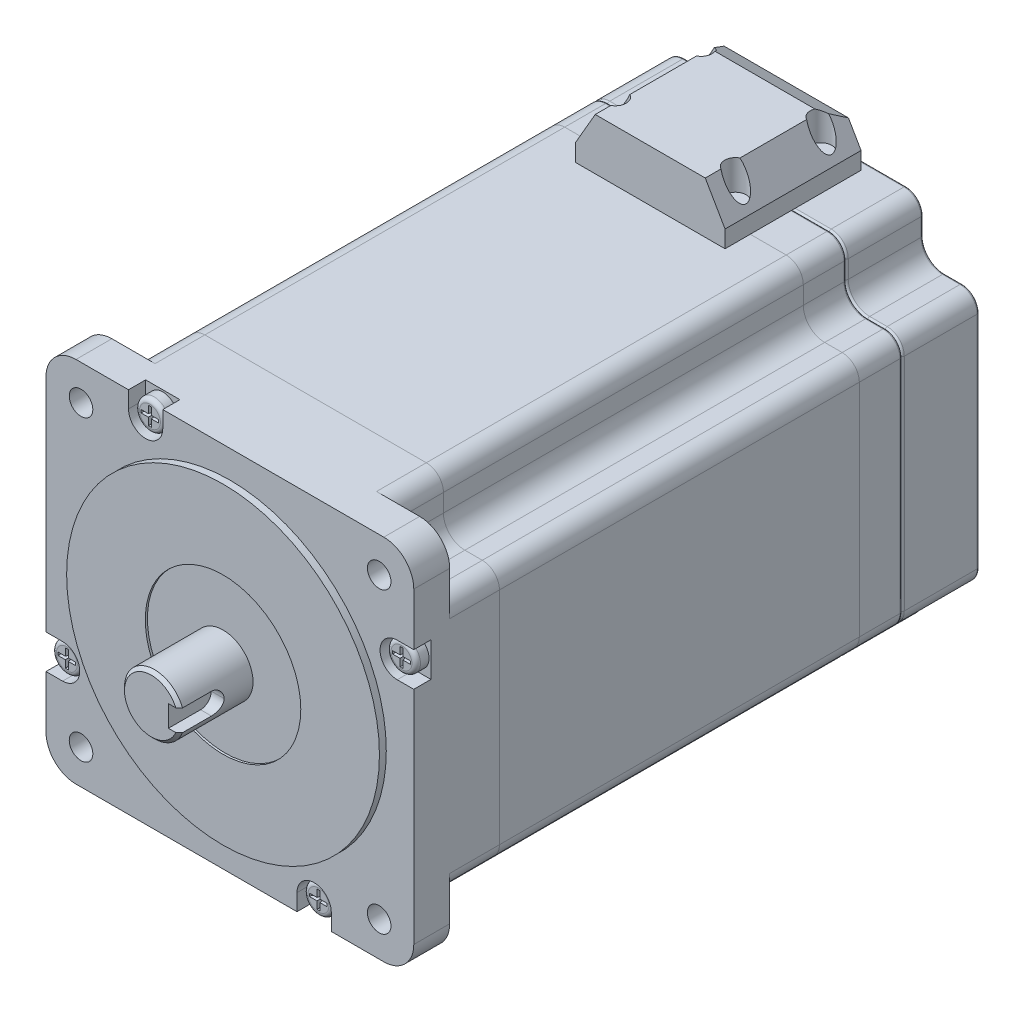
from build123d import *
from OCP.BRepFilletAPI import BRepFilletAPI_MakeChamfer

# Parameters (mm, degrees)
SKETCH1_R                = 2.75
BOSS_EXTRUDE1_DEPTH      = 114
SKETCH2_R                = 36.51
BOSS_EXTRUDE2_DEPTH      = 1.6
BOSS_EXTRUDE3_DEPTH      = 31.75
BOSS_EXTRUDE3_DEPTH_BACK = 5
SKETCH3_R                = 7
SKETCH4_W                = 5
SKETCH4_H                = 5
CUT_EXTRUDE1_DEPTH       = 25
FILLET1_R                = 2.5
CHAMFER1_SIZE            = 0.5
SKETCH5_R                = 18.150459798
CUT_EXTRUDE2_DEPTH       = 0.5
CUT_EXTRUDE3_DEPTH       = 105.62
FILLET2_R                = 0.5
FILLET3_R                = 4
SKETCH8_R                = 10
CUT_EXTRUDE4_DEPTH       = 1
SKETCH9_R                = 6
BOSS_EXTRUDE4_DEPTH      = 0.8
CUT_EXTRUDE5_DEPTH       = 4
SKETCH11_R               = 3.434192677
BOSS_EXTRUDE5_DEPTH      = 3
FILLET4_R                = 1
CUT_EXTRUDE6_DEPTH       = 2
CUT_EXTRUDE6_DRAFT       = -6
CHAMFER2_SIZE            = 1.5
CHAMFER2_SIZE2           = 1.685405696
CIRPATTERN3_COUNT        = 4
BOSS_EXTRUDE6_DEPTH      = 18
FILLET6_R                = 0.5
SKETCH15_R               = 10
CUT_EXTRUDE7_DEPTH       = 15
CHAMFER3_SIZE            = 0.75
SKETCH16_W               = 31.75
SKETCH16_H               = 34.925
BOSS_EXTRUDE7_DEPTH      = 12
CHAMFER4_SIZE            = 8
CHAMFER4_SIZE2           = 4.618802154
CHAMFER5_SIZE            = 5
CHAMFER5_SIZE2           = 2.886751346
SKETCH17_R               = 2.5
CUT_EXTRUDE8_DEPTH       = 7


# Some blends are built 0.0001 mm under size
with BuildPart() as part:
    # Sketch1 → Boss-Extrude1 (new body)
    with BuildSketch(Plane.XY):
        with BuildLine():
            Line((-35.925, -42.925), (35.925, -42.925))
            ThreePointArc((35.925, -42.925), (40.874747468, -40.874747468), (42.925, -35.925))
            Line((42.925, -35.925), (42.925, 35.925))
            ThreePointArc((42.925, 35.925), (40.874747468, 40.874747468), (35.925, 42.925))
            Line((35.925, 42.925), (-35.925, 42.925))
            ThreePointArc((-35.925, 42.925), (-40.874747468, 40.874747468), (-42.925, 35.925))
            Line((-42.925, 35.925), (-42.925, -35.925))
            ThreePointArc((-42.925, -35.925), (-40.874747468, -40.874747468), (-35.925, -42.925))
        make_face()
        with Locations(Location((-34.75, 34.75, 0), (0, 0, 180))):
            Circle(SKETCH1_R, mode=Mode.SUBTRACT)
        with Locations(Location((34.846985, 34.75, 0), (0, 0, 180))):
            Circle(SKETCH1_R, mode=Mode.SUBTRACT)
        with Locations(Location((-34.75, -34.846985, 0), (0, 0, 180))):
            Circle(SKETCH1_R, mode=Mode.SUBTRACT)
        with Locations(Location((34.846985, -34.846985, 0), (0, 0, 180))):
            Circle(SKETCH1_R, mode=Mode.SUBTRACT)
    extrude(amount=BOSS_EXTRUDE1_DEPTH)

    # Sketch2 → Boss-Extrude2 (add)
    with BuildSketch(Plane.XY.offset(114)):
        Circle(SKETCH2_R)
    extrude(amount=BOSS_EXTRUDE2_DEPTH)

    # Sketch3 → Boss-Extrude3 (add, two sides: drawn at the far end of the back side and taken through both)
    with BuildSketch(Plane.XY.offset(115.6).offset(-BOSS_EXTRUDE3_DEPTH_BACK)):
        Circle(SKETCH3_R)
    extrude(amount=BOSS_EXTRUDE3_DEPTH + BOSS_EXTRUDE3_DEPTH_BACK)

    # Sketch4 → Cut-Extrude1 (cut)
    with BuildSketch(Plane.XY.offset(147.35)):
        with Locations((6.5, 0)):
            Rectangle(SKETCH4_W, SKETCH4_H)
    extrude(amount=-CUT_EXTRUDE1_DEPTH, mode=Mode.SUBTRACT)

    # Fillet1
    fillet1_edges = [part.edges().sort_by_distance(p)[0] for p in [
        (5.269174208, -2.5, 122.35),
        (5.269174208, 2.5, 122.35),
    ]]
    fillet(fillet1_edges, radius=FILLET1_R - 0.0001)  # a hair under: the kernel refuses the full size

    # Chamfer1
    chamfer1_edges = [part.edges().sort_by_distance(p)[0] for p in [
        (-7, 0, 147.35),
    ]]
    chamfer(chamfer1_edges, length=CHAMFER1_SIZE)

    # Sketch5 → Cut-Extrude2 (cut)
    with BuildSketch(Plane.XY.offset(115.6)):
        Circle(SKETCH5_R)
    extrude(amount=-CUT_EXTRUDE2_DEPTH, mode=Mode.SUBTRACT)


with BuildPart() as cut_extrude2_piece_1:
    # of the separate pieces the step leaves, piece 1, a body of its own (cut_extrude2_pieces)
    add(part.part.solids().sort_by_distance((36.51, 0, 115.6))[0])

    # Sketch6 → Cut-Extrude3 (cut)
    with BuildSketch(Plane(origin=(0, 0, 0), x_dir=(-1, 0, 0), z_dir=(0, 0, -1))):
        with BuildLine():
            Line((-29.846985, 34.75), (-29.846985, 42.925))
            Line((-29.846985, 42.925), (-35.925, 42.925))
            ThreePointArc((-35.925, 42.925), (-40.874747468, 40.874747468), (-42.925, 35.925))
            Line((-42.925, 35.925), (-42.925, 29.75))
            Line((-42.925, 29.75), (-34.846985, 29.75))
            ThreePointArc((-34.846985, 29.75), (-31.311451094, 31.214466094), (-29.846985, 34.75))
        make_face()
        with BuildLine():
            Line((35.925, 42.925), (29.846985, 42.925))
            Line((29.846985, 42.925), (29.846985, 34.75))
            ThreePointArc((29.846985, 34.75), (31.311451094, 31.214466094), (34.846985, 29.75))
            Line((34.846985, 29.75), (42.925, 29.75))
            Line((42.925, 29.75), (42.925, 35.925))
            ThreePointArc((42.925, 35.925), (40.874747468, 40.874747468), (35.925, 42.925))
        make_face()
        with BuildLine():
            Line((29.846985, -34.75), (29.846985, -42.925))
            Line((29.846985, -42.925), (35.925, -42.925))
            ThreePointArc((35.925, -42.925), (40.874747468, -40.874747468), (42.925, -35.925))
            Line((42.925, -35.925), (42.925, -29.75))
            Line((42.925, -29.75), (34.846985, -29.75))
            ThreePointArc((34.846985, -29.75), (31.311451094, -31.214466094), (29.846985, -34.75))
        make_face()
        with BuildLine():
            Line((-35.925, -42.925), (-29.846985, -42.925))
            Line((-29.846985, -42.925), (-29.846985, -34.75))
            ThreePointArc((-29.846985, -34.75), (-31.311451094, -31.214466094), (-34.846985, -29.75))
            Line((-34.846985, -29.75), (-42.925, -29.75))
            Line((-42.925, -29.75), (-42.925, -35.925))
            ThreePointArc((-42.925, -35.925), (-40.874747468, -40.874747468), (-35.925, -42.925))
        make_face()
    extrude(amount=-CUT_EXTRUDE3_DEPTH, mode=Mode.SUBTRACT)

    # Fillet2
    fillet2_edges = [cut_extrude2_piece_1.edges().sort_by_distance(p)[0] for p in [
        (0, 42.925, 0),
        (31.311451094, 31.214466094, 0),
        (29.846985, 38.8375, 0),
        (38.8859925, 29.75, 0),
        (-42.925, 0, 0),
        (-29.846985, 38.8375, 0),
        (-31.311451094, 31.214466094, 0),
        (-38.8859925, 29.75, 0),
        (0, -42.925, 0),
        (-31.311451094, -31.214466094, 0),
        (-29.846985, -38.8375, 0),
        (-38.8859925, -29.75, 0),
        (42.925, 0, 0),
        (29.846985, -38.8375, 0),
        (31.311451094, -31.214466094, 0),
        (38.8859925, -29.75, 0),
    ]]
    fillet(fillet2_edges, radius=FILLET2_R)

    # Fillet3
    # the kernel refuses this fillet: 4 mm, written as the material it takes off along each edge
    with BuildSketch(Plane(origin=(-38.925, 25.75, 0), x_dir=(-1, 0, 0), z_dir=(0, -1, 0))) as fillet3_piece_1:
        with BuildLine():
            CenterArc((3.5, -0.5), 0.5, 0, 90)
            Line((4, -0.5), (4, 0))
            Line((4, 0), (3.5, 0))
        make_face()
    revolve(axis=Axis((-38.925, 25.75, 0), (0, 0, -1)), revolution_arc=90, mode=Mode.SUBTRACT)
    with BuildSketch(Plane(origin=(-38.925, -25.75, 0), x_dir=(0, -1, 0), z_dir=(1, 0, 0))) as fillet3_piece_2:
        with BuildLine():
            CenterArc((3.5, -0.5), 0.5, 0, 90)
            Line((4, -0.5), (4, 0))
            Line((4, 0), (3.5, 0))
        make_face()
    revolve(axis=Axis((-38.925, -25.75, 0), (0, 0, -1)), revolution_arc=90, mode=Mode.SUBTRACT)
    with BuildSketch(Plane(origin=(-25.846985, 38.925, 0), x_dir=(-1, 0, 0), z_dir=(0, -1, 0))) as fillet3_piece_3:
        with BuildLine():
            CenterArc((3.5, -0.5), 0.5, 0, 90)
            Line((4, -0.5), (4, 0))
            Line((4, 0), (3.5, 0))
        make_face()
    revolve(axis=Axis((-25.846985, 38.925, 0), (0, 0, -1)), revolution_arc=90, mode=Mode.SUBTRACT)
    with BuildSketch(Plane(origin=(25.846985, 38.925, 0), x_dir=(0, 1, 0), z_dir=(-1, 0, 0))) as fillet3_piece_4:
        with BuildLine():
            CenterArc((3.5, -0.5), 0.5, 0, 90)
            Line((4, -0.5), (4, 0))
            Line((4, 0), (3.5, 0))
        make_face()
    revolve(axis=Axis((25.846985, 38.925, 0), (0, 0, -1)), revolution_arc=90, mode=Mode.SUBTRACT)
    with BuildSketch(Plane(origin=(-25.846985, -38.925, 0), x_dir=(0, -1, 0), z_dir=(1, 0, 0))) as fillet3_piece_5:
        with BuildLine():
            CenterArc((3.5, -0.5), 0.5, 0, 90)
            Line((4, -0.5), (4, 0))
            Line((4, 0), (3.5, 0))
        make_face()
    revolve(axis=Axis((-25.846985, -38.925, 0), (0, 0, -1)), revolution_arc=90, mode=Mode.SUBTRACT)
    with BuildSketch(Plane(origin=(25.846985, -38.925, 0), x_dir=(1, 0, 0), z_dir=(0, 1, 0))) as fillet3_piece_6:
        with BuildLine():
            CenterArc((3.5, -0.5), 0.5, 0, 90)
            Line((4, -0.5), (4, 0))
            Line((4, 0), (3.5, 0))
        make_face()
    revolve(axis=Axis((25.846985, -38.925, 0), (0, 0, -1)), revolution_arc=90, mode=Mode.SUBTRACT)
    with BuildSketch(Plane(origin=(38.925, 25.75, 0), x_dir=(0, 1, 0), z_dir=(-1, 0, 0))) as fillet3_piece_7:
        with BuildLine():
            CenterArc((3.5, -0.5), 0.5, 0, 90)
            Line((4, -0.5), (4, 0))
            Line((4, 0), (3.5, 0))
        make_face()
    revolve(axis=Axis((38.925, 25.75, 0), (0, 0, -1)), revolution_arc=90, mode=Mode.SUBTRACT)
    with BuildSketch(Plane(origin=(38.925, -25.75, 0), x_dir=(1, 0, 0), z_dir=(0, 1, 0))) as fillet3_piece_8:
        with BuildLine():
            CenterArc((3.5, -0.5), 0.5, 0, 90)
            Line((4, -0.5), (4, 0))
            Line((4, 0), (3.5, 0))
        make_face()
    revolve(axis=Axis((38.925, -25.75, 0), (0, 0, -1)), revolution_arc=90, mode=Mode.SUBTRACT)
    with BuildSketch(Plane(origin=(-42.925, -29.75, 0), x_dir=(0, 1, 0), z_dir=(0, 0, 1)), Plane(origin=(-29.846985, 42.925, 0), x_dir=(1, 0, 0), z_dir=(0, 0, 1)), Plane(origin=(42.925, 29.75, 0), x_dir=(0, -1, 0), z_dir=(0, 0, 1)), Plane(origin=(29.846985, -42.925, 0), x_dir=(-1, 0, 0), z_dir=(0, 0, 1)), Plane(origin=(-29.846985, -42.925, 0), x_dir=(0, 1, 0), z_dir=(0, 0, 1))) as fillet3_piece_9:
        with BuildLine():
            CenterArc((FILLET3_R, -FILLET3_R), FILLET3_R, 90, 90)
            Line((0, -FILLET3_R), (0, 0))
            Line((0, 0), (FILLET3_R, 0))
        make_face()
    extrude(amount=105.62, mode=Mode.SUBTRACT)
    with BuildSketch(Plane(origin=(-42.925, 29.75, 0), x_dir=(0, -1, 0), z_dir=(0, 0, 1)), Plane(origin=(29.846985, 42.925, 0), x_dir=(-1, 0, 0), z_dir=(0, 0, 1)), Plane(origin=(42.925, -29.75, 0), x_dir=(0, 1, 0), z_dir=(0, 0, 1))) as fillet3_piece_10:
        with BuildLine():
            CenterArc((FILLET3_R, FILLET3_R), FILLET3_R, 180, 90)
            Line((0, FILLET3_R), (0, 0))
            Line((0, 0), (FILLET3_R, 0))
        make_face()
    extrude(amount=105.62, mode=Mode.SUBTRACT)

    # Sketch8 → Cut-Extrude4 (cut)
    with BuildSketch(Plane(origin=(0, 0, 0), x_dir=(-1, 0, 0), z_dir=(0, 0, -1))):
        Circle(SKETCH8_R)
    extrude(amount=-CUT_EXTRUDE4_DEPTH, mode=Mode.SUBTRACT)

    # Sketch10 → Cut-Extrude5 (cut)
    with BuildSketch(Plane.XY.offset(114)):
        with BuildLine():
            Line((-23.668230311, 39.056860772), (-23.668230311, 42.925))
            Line((-23.668230311, 42.925), (-15.668230311, 42.925))
            Line((-15.668230311, 42.925), (-15.668230311, 39.056860772))
            ThreePointArc((-15.668230311, 39.056860772), (-19.668230311, 35.056860772), (-23.668230311, 39.056860772))
        make_face()
        with BuildLine():
            Line((39.056860772, 23.668230311), (42.925, 23.668230311))
            Line((42.925, 23.668230311), (42.925, 15.668230311))
            Line((42.925, 15.668230311), (39.056860772, 15.668230311))
            ThreePointArc((39.056860772, 15.668230311), (35.056860772, 19.668230311), (39.056860772, 23.668230311))
        make_face()
        with BuildLine():
            Line((23.668230311, -39.056860772), (23.668230311, -42.925))
            Line((23.668230311, -42.925), (15.668230311, -42.925))
            Line((15.668230311, -42.925), (15.668230311, -39.056860772))
            ThreePointArc((15.668230311, -39.056860772), (19.668230311, -35.056860772), (23.668230311, -39.056860772))
        make_face()
        with BuildLine():
            Line((-39.056860772, -23.668230311), (-42.925, -23.668230311))
            Line((-42.925, -23.668230311), (-42.925, -15.668230311))
            Line((-42.925, -15.668230311), (-39.056860772, -15.668230311))
            ThreePointArc((-39.056860772, -15.668230311), (-35.056860772, -19.668230311), (-39.056860772, -23.668230311))
        make_face()
    extrude(amount=-CUT_EXTRUDE5_DEPTH, mode=Mode.SUBTRACT)

    # Sketch14 → Boss-Extrude6 (add)
    with BuildSketch(Plane(origin=(0, 0, 0), x_dir=(-1, 0, 0), z_dir=(0, 0, -1))):
        with BuildLine():
            Line((-25.846985, 42.925), (25.846985, 42.925))
            ThreePointArc((25.846985, 42.925), (28.675412125, 41.753427125), (29.846985, 38.925))
            Line((29.846985, 38.925), (29.846985, 34.75))
            ThreePointArc((29.846985, 34.75), (31.311451094, 31.214466094), (34.846985, 29.75))
            Line((34.846985, 29.75), (38.925, 29.75))
            ThreePointArc((38.925, 29.75), (41.753427125, 28.578427125), (42.925, 25.75))
            Line((42.925, 25.75), (42.925, -25.75))
            ThreePointArc((42.925, -25.75), (41.753427125, -28.578427125), (38.925, -29.75))
            Line((38.925, -29.75), (34.846985, -29.75))
            ThreePointArc((34.846985, -29.75), (31.311451094, -31.214466094), (29.846985, -34.75))
            Line((29.846985, -34.75), (29.846985, -38.925))
            ThreePointArc((29.846985, -38.925), (28.675412125, -41.753427125), (25.846985, -42.925))
            Line((25.846985, -42.925), (-25.846985, -42.925))
            ThreePointArc((-25.846985, -42.925), (-28.675412125, -41.753427125), (-29.846985, -38.925))
            Line((-29.846985, -38.925), (-29.846985, -34.75))
            ThreePointArc((-29.846985, -34.75), (-31.311451094, -31.214466094), (-34.846985, -29.75))
            Line((-34.846985, -29.75), (-38.925, -29.75))
            ThreePointArc((-38.925, -29.75), (-41.753427125, -28.578427125), (-42.925, -25.75))
            Line((-42.925, -25.75), (-42.925, 25.75))
            ThreePointArc((-42.925, 25.75), (-41.753427125, 28.578427125), (-38.925, 29.75))
            Line((-38.925, 29.75), (-34.846985, 29.75))
            ThreePointArc((-34.846985, 29.75), (-31.311451094, 31.214466094), (-29.846985, 34.75))
            Line((-29.846985, 34.75), (-29.846985, 38.925))
            ThreePointArc((-29.846985, 38.925), (-28.675412125, 41.753427125), (-25.846985, 42.925))
        make_face()
    extrude(amount=BOSS_EXTRUDE6_DEPTH)

    # Fillet6
    fillet6_edges = [cut_extrude2_piece_1.edges().sort_by_distance(p)[0] for p in [
        (28.675412125, 41.753427125, 0),
        (29.846985, 36.8375, 0),
        (31.311451094, 31.214466094, 0),
        (36.8859925, 29.75, 0),
        (41.753427125, 28.578427125, 0),
        (42.925, 0, 0),
        (41.753427125, -28.578427125, 0),
        (36.8859925, -29.75, 0),
        (31.311451094, -31.214466094, 0),
        (29.846985, -36.8375, 0),
        (28.675412125, -41.753427125, 0),
        (0, -42.925, 0),
        (-28.675412125, -41.753427125, 0),
        (-29.846985, -36.8375, 0),
        (-31.311451094, -31.214466094, 0),
        (-36.8859925, -29.75, 0),
        (-41.753427125, -28.578427125, 0),
        (-42.925, 0, 0),
        (-41.753427125, 28.578427125, 0),
        (-36.8859925, 29.75, 0),
        (-31.311451094, 31.214466094, 0),
        (-29.846985, 36.8375, 0),
        (-28.675412125, 41.753427125, 0),
        (0, 42.925, 0),
        (28.675412125, 41.753427125, -18),
        (29.846985, 36.8375, -18),
        (31.311451094, 31.214466094, -18),
        (36.8859925, 29.75, -18),
        (41.753427125, 28.578427125, -18),
        (42.925, 0, -18),
        (41.753427125, -28.578427125, -18),
        (36.8859925, -29.75, -18),
        (31.311451094, -31.214466094, -18),
        (29.846985, -36.8375, -18),
        (28.675412125, -41.753427125, -18),
        (0, -42.925, -18),
        (-28.675412125, -41.753427125, -18),
        (-29.846985, -36.8375, -18),
        (-31.311451094, -31.214466094, -18),
        (-36.8859925, -29.75, -18),
        (-41.753427125, -28.578427125, -18),
        (-42.925, 0, -18),
        (-41.753427125, 28.578427125, -18),
        (-36.8859925, 29.75, -18),
        (-31.311451094, 31.214466094, -18),
        (-29.846985, 36.8375, -18),
        (-28.675412125, 41.753427125, -18),
        (0, 42.925, -18),
    ]]
    fillet(fillet6_edges, radius=FILLET6_R - 0.0001)  # a hair under: the kernel refuses the full size

    # Sketch16 → Boss-Extrude7 (add)
    with BuildSketch(Plane(origin=(0, 42.925, 0), x_dir=(0, 0, 1), z_dir=(0, -1, 0))):
        Rectangle(SKETCH16_W, SKETCH16_H)
    extrude(amount=-BOSS_EXTRUDE7_DEPTH)

    # Chamfer4: one chamfer whose edges measure the first distance from different faces: ONE call of the kernel's chamfer builder (chamfer() names one face for all edges)
    chamfer4_edges_1 = [cut_extrude2_piece_1.edges().sort_by_distance(p)[0] for p in [
        (-17.4625, 54.925, 0),
    ]]
    chamfer4_side_1 = [cut_extrude2_piece_1.faces().sort_by_distance(p)[0] for p in [
        (-17.4625, 48.925, 0),
    ]]
    chamfer4_edges_2 = [cut_extrude2_piece_1.edges().sort_by_distance(p)[0] for p in [
        (17.4625, 54.925, 0),
    ]]
    chamfer4_side_2 = [cut_extrude2_piece_1.faces().sort_by_distance(p)[0] for p in [
        (17.4625, 48.925, 0),
    ]]
    chamfer4 = BRepFilletAPI_MakeChamfer(cut_extrude2_piece_1.part.solid().wrapped)
    for e in chamfer4_edges_1:
        chamfer4.Add(CHAMFER4_SIZE, CHAMFER4_SIZE2, e.wrapped, chamfer4_side_1[0].wrapped)  # the first distance lies on this face
    for e in chamfer4_edges_2:
        chamfer4.Add(CHAMFER4_SIZE, CHAMFER4_SIZE2, e.wrapped, chamfer4_side_2[0].wrapped)  # the first distance lies on this face
    add(Compound.cast(chamfer4.Shape()), mode=Mode.REPLACE)

    # Chamfer5
    chamfer5_edges = [cut_extrude2_piece_1.edges().sort_by_distance(p)[0] for p in [
        (0, 54.925, -15.875),
    ]]
    chamfer5_side = [cut_extrude2_piece_1.faces().sort_by_distance(p)[0] for p in [
        (0, 54.925, 0),
    ]]
    chamfer(chamfer5_edges, length=CHAMFER5_SIZE, length2=CHAMFER5_SIZE2, reference=chamfer5_side[0])

    # Sketch17 → Cut-Extrude8 (cut)
    with BuildSketch(Plane.ZX.offset(54.925)):
        with Locations(Location((-10, 14, 0), (0, 0, 270))):
            Circle(SKETCH17_R)
        with Locations(Location((-10, -14, 0), (0, 0, 270))):
            Circle(SKETCH17_R)
        with Locations(Location((10, -14, 0), (0, 0, 270))):
            Circle(SKETCH17_R)
        with Locations(Location((10, 14, 0), (0, 0, 270))):
            Circle(SKETCH17_R)
    extrude(amount=-CUT_EXTRUDE8_DEPTH, mode=Mode.SUBTRACT)


with BuildPart() as cut_extrude2_piece_2:
    # of the separate pieces the step leaves, piece 2, a body of its own (cut_extrude2_pieces)
    add(part.part.solids().sort_by_distance((6.538348415, -2.5, 146.85))[0])

    # Sketch15 → Cut-Extrude7 (cut)
    with BuildSketch(Plane.XY.offset(147.35)):
        with Locations(Location((0, 0, 0), (0, 0, 180))):
            Circle(SKETCH15_R)
    extrude(amount=-CUT_EXTRUDE7_DEPTH, mode=Mode.SUBTRACT)

    # Chamfer3
    chamfer3_edges = [cut_extrude2_piece_2.edges().sort_by_distance(p)[0] for p in [
        (-7, 0, 132.35),
    ]]
    chamfer(chamfer3_edges, length=CHAMFER3_SIZE)


with BuildPart() as body_3:
    # Sketch9 → Boss-Extrude4 (new body)
    with BuildSketch(Plane(origin=(0, 0, 1), x_dir=(-1, 0, 0), z_dir=(0, 0, -1))):
        Circle(SKETCH9_R)
    extrude(amount=BOSS_EXTRUDE4_DEPTH)


with BuildPart() as body_4:
    # Sketch11 → Boss-Extrude5 (new body)
    with BuildSketch(Plane.XY.offset(110)):
        with Locations((-19.668230311, 39.056860772)):
            Circle(SKETCH11_R)
    extrude(amount=BOSS_EXTRUDE5_DEPTH)

    # Fillet4
    fillet4_edges = [body_4.edges().sort_by_distance(p)[0] for p in [
        (-23.102422989, 39.056860772, 113),
    ]]
    fillet(fillet4_edges, radius=FILLET4_R)


with BuildPart() as cut_extrude6_tool:
    # Sketch12 → Cut-Extrude6 (with draft: the straight prism first)
    with BuildSketch(Plane.XY.offset(113)):
        Polygon((-19.317907501, 39.406818019), (-19.317907501, 41.116130582), (-20.018553122, 41.116130582), (-20.018553122, 39.406818019), (-21.725351266, 39.406818019), (-21.725351266, 38.706903524), (-20.018553122, 38.706903524), (-20.018553122, 36.997590961), (-19.317907501, 36.997590961), (-19.317907501, 38.706903524), (-17.611109357, 38.706903524), (-17.611109357, 39.406818019), align=None)
    extrude(amount=-CUT_EXTRUDE6_DEPTH)
    # Cut-Extrude6: the draft: its side faces are tilted about the plane it starts from
    cut_extrude6_sides = [cut_extrude6_tool.faces().sort_by_distance(p)[0] for p in [
        (-19.317907501, 40.261474301, 112),
        (-19.668230311, 41.116130582, 112),
        (-20.018553122, 40.261474301, 112),
        (-20.871952194, 39.406818019, 112),
        (-21.725351266, 39.056860772, 112),
        (-20.871952194, 38.706903524, 112),
        (-20.018553122, 37.852247243, 112),
        (-19.668230311, 36.997590961, 112),
        (-19.317907501, 37.852247243, 112),
        (-18.464508429, 38.706903524, 112),
        (-17.611109357, 39.056860772, 112),
        (-18.464508429, 39.406818019, 112),
    ]]
    draft(cut_extrude6_sides, Plane.XY.offset(113), CUT_EXTRUDE6_DRAFT)


with BuildPart() as body_4_1:
    add(body_4.part)

    # Cut-Extrude6: cut by cut_extrude6_tool
    add(cut_extrude6_tool.part, mode=Mode.SUBTRACT)

    # Chamfer2: one chamfer whose edges measure the first distance from different faces: ONE call of the kernel's chamfer builder (chamfer() names one face for all edges)
    chamfer2_edges_1 = [body_4_1.edges().sort_by_distance(p)[0] for p in [
        (-17.821317827, 39.056860772, 111),
    ]]
    chamfer2_side_1 = [body_4_1.faces().sort_by_distance(p)[0] for p in [
        (-17.701174773, 39.056860772, 112.143084803),
    ]]
    chamfer2_edges_2 = [body_4_1.edges().sort_by_distance(p)[0] for p in [
        (-19.668230311, 37.207799432, 111),
    ]]
    chamfer2_side_2 = [body_4_1.faces().sort_by_distance(p)[0] for p in [
        (-19.668230311, 37.087678797, 112.142871497),
    ]]
    chamfer2_edges_3 = [body_4_1.edges().sort_by_distance(p)[0] for p in [
        (-21.515142796, 39.056860772, 111),
    ]]
    chamfer2_side_3 = [body_4_1.faces().sort_by_distance(p)[0] for p in [
        (-21.63528585, 39.056860772, 112.143084803),
    ]]
    chamfer2_edges_4 = [body_4_1.edges().sort_by_distance(p)[0] for p in [
        (-19.668230311, 40.905922111, 111),
    ]]
    chamfer2_side_4 = [body_4_1.faces().sort_by_distance(p)[0] for p in [
        (-19.668230311, 41.026042746, 112.142871497),
    ]]
    chamfer2 = BRepFilletAPI_MakeChamfer(body_4_1.part.solid().wrapped)
    for e in chamfer2_edges_1:
        chamfer2.Add(CHAMFER2_SIZE, CHAMFER2_SIZE2, e.wrapped, chamfer2_side_1[0].wrapped)  # the first distance lies on this face
    for e in chamfer2_edges_2:
        chamfer2.Add(CHAMFER2_SIZE, CHAMFER2_SIZE2, e.wrapped, chamfer2_side_2[0].wrapped)  # the first distance lies on this face
    for e in chamfer2_edges_3:
        chamfer2.Add(CHAMFER2_SIZE, CHAMFER2_SIZE2, e.wrapped, chamfer2_side_3[0].wrapped)  # the first distance lies on this face
    for e in chamfer2_edges_4:
        chamfer2.Add(CHAMFER2_SIZE, CHAMFER2_SIZE2, e.wrapped, chamfer2_side_4[0].wrapped)  # the first distance lies on this face
    add(Compound.cast(chamfer2.Shape()), mode=Mode.REPLACE)


with BuildPart() as cirpattern3_1:
    # CirPattern3: pattern copy
    add(body_4_1.part.rotate(Axis((0, 0, 0), (0, 0, 1)), 1 * 360 / CIRPATTERN3_COUNT))


with BuildPart() as cirpattern3_2:
    # CirPattern3: pattern copy
    add(body_4_1.part.rotate(Axis((0, 0, 0), (0, 0, 1)), 2 * 360 / CIRPATTERN3_COUNT))


with BuildPart() as cirpattern3_3:
    # CirPattern3: pattern copy
    add(body_4_1.part.rotate(Axis((0, 0, 0), (0, 0, 1)), 3 * 360 / CIRPATTERN3_COUNT))


solid = Compound([cut_extrude2_piece_1.part, cut_extrude2_piece_2.part, body_3.part, body_4_1.part, cirpattern3_1.part, cirpattern3_2.part, cirpattern3_3.part])
